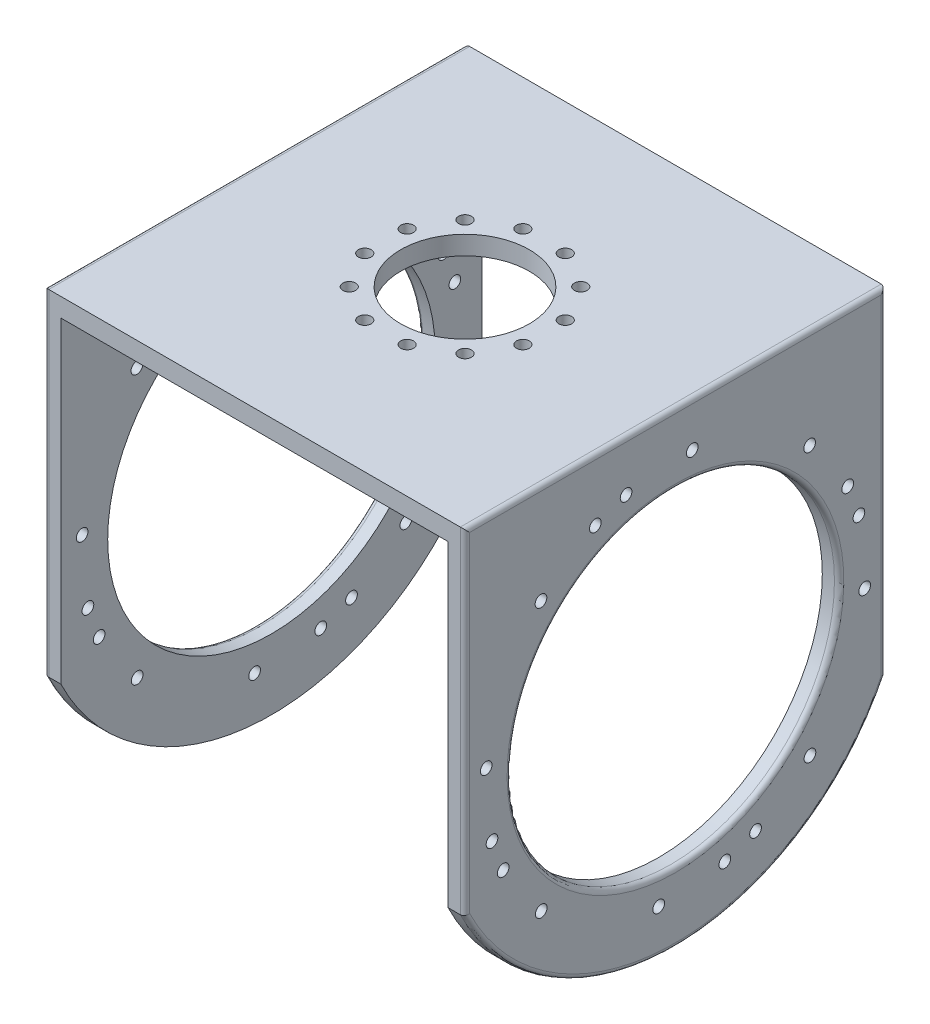
from build123d import *

# Parameters (mm, degrees)
EXTRUDE_1_DEPTH          = 180
SKETCH_2_R               = 27.5
CUT_EXTRUDE_1_DEPTH      = 180
SKETCH_3_R               = 70
CUT_EXTRUDE_2_DEPTH      = 217
CUT_EXTRUDE_5_DEPTH      = 324.728281125
CUT_EXTRUDE_5_DEPTH_BACK = 324.728281125
FILLET_2_R               = 2
CUT_EXTRUDE_6_DEPTH      = 324.728281298
CUT_EXTRUDE_6_DEPTH_BACK = 324.728281298
SKETCH_10_R              = 2.5
SKETCH_11_R              = 2.75
CUT_EXTRUDE_7_DEPTH      = 29


with BuildPart() as part:
    # 草图1 → 凸台-拉伸1 (new body)
    with BuildSketch(Plane.XY):
        Polygon((-90, 200), (90, 200), (90, 0), (82.8, 0), (82.8, 192), (-82.8, 192), (-82.8, 0), (-90, 0), align=None)
    extrude(amount=EXTRUDE_1_DEPTH)

    # 草图2 → 切除-拉伸1 (cut)
    with BuildSketch(Plane(origin=(0, 200, 0), x_dir=(1, 0, 0), z_dir=(0, 1, 0))):
        with Locations((0, -90)):
            Circle(SKETCH_2_R)
    extrude(amount=-CUT_EXTRUDE_1_DEPTH, mode=Mode.SUBTRACT)

    # 草图3 → 切除-拉伸2 (cut)
    with BuildSketch(Plane(origin=(90, 0, 0), x_dir=(0, 0, -1), z_dir=(1, 0, 0))):
        with Locations((-90, 100)):
            Circle(SKETCH_3_R)
    extrude(amount=-CUT_EXTRUDE_2_DEPTH, mode=Mode.SUBTRACT)

    # 草图9 → 切除-拉伸5 (cut, two sides: drawn at the far end of the back side and taken through both)
    with BuildSketch(Plane(origin=(90, 0, 0), x_dir=(0, 0, -1), z_dir=(1, 0, 0)).offset(-CUT_EXTRUDE_5_DEPTH_BACK)):
        with BuildLine():
            Line((0, 0), (0, 56.411010565))
            ThreePointArc((0, 56.411010565), (-36.891144692, 15.268367844), (-90.000000357, 0))
            Line((-90.000000357, 0), (0, 0))
        make_face()
        with BuildLine():
            Line((-180, 0), (-90.000000357, 0))
            ThreePointArc((-90.000000357, 0), (-143.108855611, 15.268368034), (-180, 56.411010565))
            Line((-180, 56.411010565), (-180, 0))
        make_face()
    extrude(amount=CUT_EXTRUDE_5_DEPTH + CUT_EXTRUDE_5_DEPTH_BACK, mode=Mode.SUBTRACT)

    # 圆角2
    fillet_2_edges = [part.edges().sort_by_distance(p)[0] for p in [
        (90, 200, 90),
        (90, 128.205505282, 0),
        (90, 0, 90),
        (90, 128.205505282, 180),
        (90, 100, 160),
        (-90, 128.205505282, 0),
        (-90, 200, 90),
        (-90, 128.205505282, 180),
        (-90, 0, 90),
        (-90, 100, 160),
    ]]
    fillet(fillet_2_edges, radius=FILLET_2_R)

    # 草图10 → 切除-拉伸6 (cut, two sides: drawn at the far end of the back side and taken through both)
    with BuildSketch(Plane(origin=(90, 0, 0), x_dir=(0, 0, -1), z_dir=(1, 0, 0)).offset(-CUT_EXTRUDE_6_DEPTH_BACK)):
        with Locations((-32.609998318, 157.514782508)):
            Circle(SKETCH_10_R)
        with Locations((-16.325246691, 134.257746931)):
            Circle(SKETCH_10_R)
        with Locations((-11.541409366, 121.114261903)):
            Circle(SKETCH_10_R)
        with Locations((-9.066918551, 92.830702464)):
            Circle(SKETCH_10_R)
        with Locations((-32.485217492, 42.609998318)):
            Circle(SKETCH_10_R)
        with Locations((-55.742253069, 26.325246691)):
            Circle(SKETCH_10_R)
        with Locations((-68.885738097, 21.541409366)):
            Circle(SKETCH_10_R)
        with Locations((-97.169297536, 19.066918551)):
            Circle(SKETCH_10_R)
        with Locations((-147.390001682, 42.485217492)):
            Circle(SKETCH_10_R)
        with Locations((-163.674753309, 65.742253069)):
            Circle(SKETCH_10_R)
        with Locations((-168.458590634, 78.885738097)):
            Circle(SKETCH_10_R)
        with Locations((-170.933081449, 107.169297536)):
            Circle(SKETCH_10_R)
        with Locations((-147.514782508, 157.390001682)):
            Circle(SKETCH_10_R)
        with Locations((-124.257746931, 173.674753309)):
            Circle(SKETCH_10_R)
        with Locations((-111.114261903, 178.458590634)):
            Circle(SKETCH_10_R)
        with Locations((-82.830702464, 180.933081449)):
            Circle(SKETCH_10_R)
    extrude(amount=CUT_EXTRUDE_6_DEPTH + CUT_EXTRUDE_6_DEPTH_BACK, mode=Mode.SUBTRACT)

    # 草图11 → 切除-拉伸7 (cut)
    with BuildSketch(Plane.XZ.offset(-192)):
        with Locations((9.058666579, 123.80740392)):
            Circle(SKETCH_11_R)
        with Locations((24.748737342, 114.748737342)):
            Circle(SKETCH_11_R)
        with Locations((33.80740392, 99.058666579)):
            Circle(SKETCH_11_R)
        with Locations((33.80740392, 80.941333421)):
            Circle(SKETCH_11_R)
        with Locations((24.748737342, 65.251262658)):
            Circle(SKETCH_11_R)
        with Locations((9.058666579, 56.19259608)):
            Circle(SKETCH_11_R)
        with Locations((-9.058666579, 56.19259608)):
            Circle(SKETCH_11_R)
        with Locations((-24.748737342, 65.251262658)):
            Circle(SKETCH_11_R)
        with Locations((-33.80740392, 80.941333421)):
            Circle(SKETCH_11_R)
        with Locations((-33.80740392, 99.058666579)):
            Circle(SKETCH_11_R)
        with Locations((-24.748737342, 114.748737342)):
            Circle(SKETCH_11_R)
        with Locations((-9.058666579, 123.80740392)):
            Circle(SKETCH_11_R)
    extrude(amount=-CUT_EXTRUDE_7_DEPTH, mode=Mode.SUBTRACT)


solid = part.part
